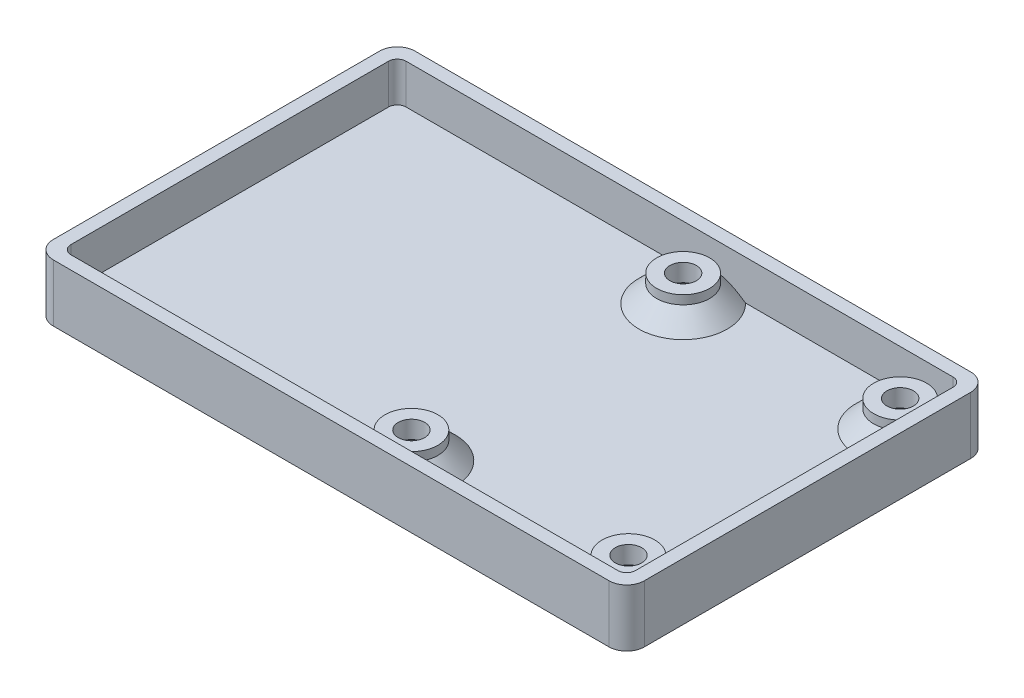
from build123d import *

# Parameters (mm, degrees)
SKETCH_1_W          = 67
SKETCH_1_H          = 41
EXTRUDE_1_DEPTH     = 6.5
SKETCH_2_W          = 64
SKETCH_2_H          = 38
CUT_EXTRUDE_1_DEPTH = 4.5
FILLET_1_R          = 1
FILLET_2_R          = 2
SKETCH_3_R          = 3
EXTRUDE_2_DEPTH     = 3
SKETCH_4_R          = 1.5
CUT_EXTRUDE_2_DEPTH = 6
CHAMFER_1_SIZE      = 3
CHAMFER_2_SIZE      = 2


with BuildPart() as part:
    # Эскиз1 → Бобышка-Вытянуть1 (new body)
    with BuildSketch(Plane(origin=(0, 0, 0), x_dir=(1, 0, 0), z_dir=(0, 1, 0))):
        Rectangle(SKETCH_1_W, SKETCH_1_H)
    extrude(amount=EXTRUDE_1_DEPTH)

    # Эскиз2 → Вырез-Вытянуть1 (cut)
    with BuildSketch(Plane(origin=(0, 6.5, 0), x_dir=(1, 0, 0), z_dir=(0, 1, 0))):
        Rectangle(SKETCH_2_W, SKETCH_2_H)
    extrude(amount=-CUT_EXTRUDE_1_DEPTH, mode=Mode.SUBTRACT)

    # Скругление1
    fillet_1_edges = [part.edges().sort_by_distance(p)[0] for p in [
        (32, 4.25, -19),
        (32, 4.25, 19),
        (-32, 4.25, 19),
        (-32, 4.25, -19),
    ]]
    fillet(fillet_1_edges, radius=FILLET_1_R)

    # Скругление2
    fillet_2_edges = [part.edges().sort_by_distance(p)[0] for p in [
        (33.5, 3.25, 20.5),
        (-33.5, 3.25, 20.5),
        (-33.5, 3.25, -20.5),
        (33.5, 3.25, -20.5),
    ]]
    fillet(fillet_2_edges, radius=FILLET_2_R)

    # Эскиз3 → Бобышка-Вытянуть2 (add)
    with BuildSketch(Plane(origin=(0, 2, 0), x_dir=(1, 0, 0), z_dir=(0, 1, 0))):
        with Locations(Location((28.6, 15.4, 0), (0, 0, 270))):
            Circle(SKETCH_3_R)
        with Locations(Location((4, 15.4, 0), (0, 0, 270))):
            Circle(SKETCH_3_R)
        with Locations(Location((4, -15.4, 0), (0, 0, 270))):
            Circle(SKETCH_3_R)
        with Locations(Location((28.6, -15.4, 0), (0, 0, 270))):
            Circle(SKETCH_3_R)
    extrude(amount=EXTRUDE_2_DEPTH)

    # Эскиз4 → Вырез-Вытянуть2 (cut)
    with BuildSketch(Plane(origin=(0, 5, 0), x_dir=(1, 0, 0), z_dir=(0, 1, 0))):
        with Locations(Location((4, 15.4, 0), (0, 0, 270))):
            Circle(SKETCH_4_R)
        with Locations(Location((28.6, 15.4, 0), (0, 0, 270))):
            Circle(SKETCH_4_R)
        with Locations(Location((28.6, -15.4, 0), (0, 0, 270))):
            Circle(SKETCH_4_R)
        with Locations(Location((4, -15.4, 0), (0, 0, 270))):
            Circle(SKETCH_4_R)
    extrude(amount=-CUT_EXTRUDE_2_DEPTH, mode=Mode.SUBTRACT)

    # Фаска1
    chamfer_1_edges = [part.edges().sort_by_distance(p)[0] for p in [
        (28.6, 0, -16.9),
        (4, 0, -16.9),
        (4, 0, 13.9),
        (28.6, 0, 13.9),
    ]]
    chamfer(chamfer_1_edges, length=CHAMFER_1_SIZE)

    # Фаска2
    # the kernel refuses this chamfer: 2 mm, written as the material it adds along each edge
    with BuildSketch(Plane(origin=(28.6, 2, -15.4), x_dir=(0, 0, 1), z_dir=(-1, 0, 0))) as chamfer_2_piece_1_section:
        Polygon((3, CHAMFER_2_SIZE), (3 + CHAMFER_2_SIZE, 0), (3, 0), align=None)
    chamfer_2_piece_1 = revolve(axis=Axis((28.6, 2, -15.4), (0, 1, 0)), mode=Mode.PRIVATE)
    chamfer_2_piece_1 = split(chamfer_2_piece_1, bisect_by=Plane(origin=(32, 3.643767664, -12.314318949), z_dir=(-1, 0, 0)), keep=Keep.TOP, mode=Mode.PRIVATE)
    add(chamfer_2_piece_1)
    with BuildSketch(Plane(origin=(4, 2, -15.4), x_dir=(0, 0, 1), z_dir=(-1, 0, 0))) as chamfer_2_piece_2:
        Polygon((3 + CHAMFER_2_SIZE, 0), (3, CHAMFER_2_SIZE), (3, 0), align=None)
    revolve(axis=Axis((4, 2, -15.4), (0, 1, 0)))
    with BuildSketch(Plane(origin=(28.6, 2, 15.4), x_dir=(0, 0, 1), z_dir=(-1, 0, 0))) as chamfer_2_piece_3_section:
        Polygon((3 + CHAMFER_2_SIZE, 0), (3, CHAMFER_2_SIZE), (3, 0), align=None)
    chamfer_2_piece_3 = revolve(axis=Axis((28.6, 2, 15.4), (0, 1, 0)), mode=Mode.PRIVATE)
    chamfer_2_piece_3 = split(chamfer_2_piece_3, bisect_by=Plane(origin=(32, 3.313770234, 18.884228213), z_dir=(-1, 0, 0)), keep=Keep.TOP, mode=Mode.PRIVATE)
    add(chamfer_2_piece_3)
    with BuildSketch(Plane(origin=(4, 2, 15.4), x_dir=(0, 0, 1), z_dir=(-1, 0, 0))) as chamfer_2_piece_4:
        Polygon((3 + CHAMFER_2_SIZE, 0), (3, CHAMFER_2_SIZE), (3, 0), align=None)
    revolve(axis=Axis((4, 2, 15.4), (0, 1, 0)))


solid = part.part
